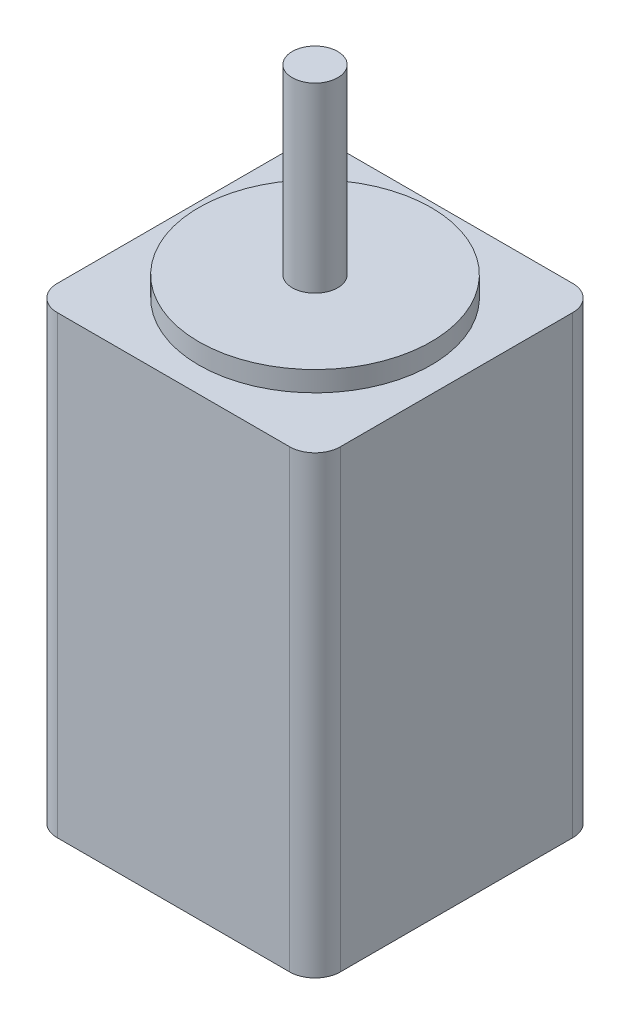
from build123d import *

# Parameters (mm, degrees)
SKETCH1_W           = 28
SKETCH1_H           = 28
BOSS_EXTRUDE1_DEPTH = 45
SKETCH2_R           = 11.5
BOSS_EXTRUDE2_DEPTH = 2
SKETCH3_R           = 2.25
BOSS_EXTRUDE3_DEPTH = 20
FILLET1_R           = 2.5


with BuildPart() as part:
    # Sketch1 → Boss-Extrude1 (new body)
    with BuildSketch(Plane(origin=(0, 0, 0), x_dir=(1, 0, 0), z_dir=(0, 1, 0))):
        Rectangle(SKETCH1_W, SKETCH1_H)
    extrude(amount=BOSS_EXTRUDE1_DEPTH)

    # Sketch2 → Boss-Extrude2 (add)
    with BuildSketch(Plane(origin=(0, 45, 0), x_dir=(1, 0, 0), z_dir=(0, 1, 0))):
        Circle(SKETCH2_R)
    extrude(amount=BOSS_EXTRUDE2_DEPTH)

    # Sketch3 → Boss-Extrude3 (add)
    with BuildSketch(Plane(origin=(0, 45, 0), x_dir=(1, 0, 0), z_dir=(0, 1, 0))):
        Circle(SKETCH3_R)
    extrude(amount=BOSS_EXTRUDE3_DEPTH)

    # Fillet1
    fillet1_edges = [part.edges().sort_by_distance(p)[0] for p in [
        (-14, 22.5, 14),
        (14, 22.5, 14),
        (14, 22.5, -14),
        (-14, 22.5, -14),
    ]]
    fillet(fillet1_edges, radius=FILLET1_R)


solid = part.part
